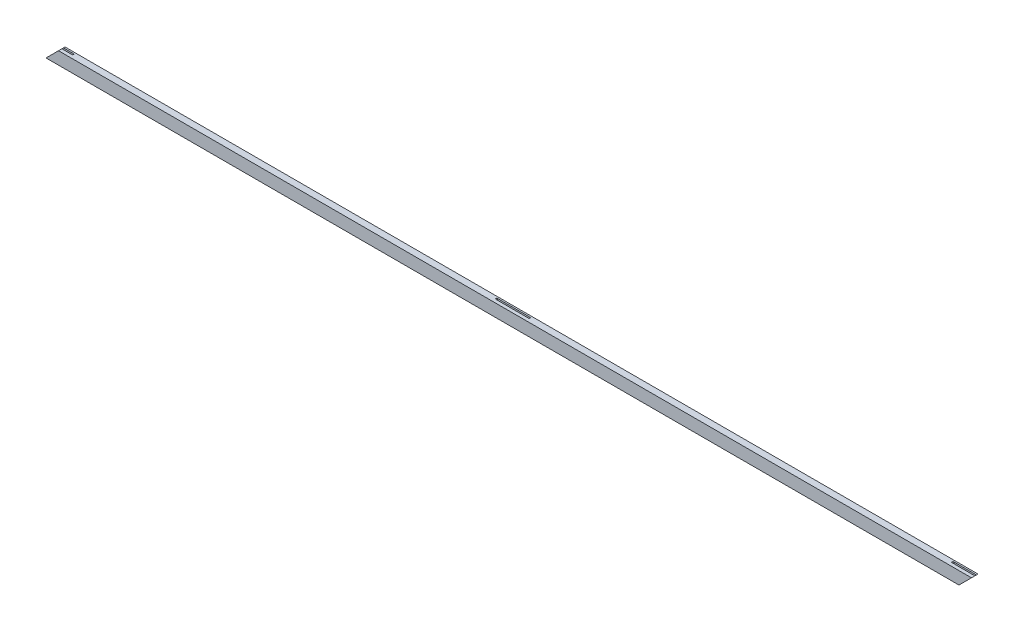
from build123d import *

# Parameters (mm, degrees)
EXTRUDE_1_DEPTH     = 25
SKETCH_2_W          = 115
SKETCH_2_H          = 6
CUT_EXTRUDE_1_DEPTH = 7.5
DRAFT_1_ANGLE       = 45
MIRROR_START        = 6
MIRROR_1_DEPTH      = 6
CUT_EXTRUDE_START   = -13
CUT_EXTRUDE_2_DEPTH = 6


# Read off the part's stored shape, not the designer's step: 镜向1
with BuildPart() as part:
    # 草图1 → 凸台-拉伸1 (new body)
    with BuildSketch(Plane.XY):
        Polygon((48, 48), (0, 0), (3498, 0), (3546, 48), align=None)
    extrude(amount=EXTRUDE_1_DEPTH)

    # 草图2 → 切除-拉伸1 (cut)
    with BuildSketch(Plane.XZ):
        with Locations((1773, 9)):
            Rectangle(SKETCH_2_W, SKETCH_2_H)
    extrude(amount=-CUT_EXTRUDE_1_DEPTH, mode=Mode.SUBTRACT)

    # 拔模1
    draft_1_faces = [part.faces().sort_by_distance(p)[0] for p in [
        (1830.5, 3.75, 9),
        (1715.5, 3.75, 9),
    ]]
    draft(draft_1_faces, Plane(origin=(0, 7.5, 0), x_dir=(0, 0, -1), z_dir=(0, -1, 0)), DRAFT_1_ANGLE)

    # 镜向1 outline → 镜向1 (cut)
    with BuildSketch(Plane.XY.offset(MIRROR_START)):
        Polygon((1708, 48), (1715.5, 40.5), (1830.5, 40.5), (1838, 48), align=None)
    extrude(amount=MIRROR_1_DEPTH, mode=Mode.SUBTRACT)

    # 草图3 → 切除-拉伸2 (cut)
    with BuildSketch(Plane.XY.offset(25).offset(CUT_EXTRUDE_START)):
        Polygon((3456.5, 48), (3464, 40.5), (3538.5, 40.5), (3546, 48), align=None)
        Polygon((3456.5, 0), (3464, 7.5), (3505.5, 7.5), (3498, 0), align=None)
        Polygon((48, 48), (40.5, 40.5), (82, 40.5), (89.5, 48), align=None)
        Polygon((0, 0), (7.5, 7.5), (82, 7.5), (89.5, 0), align=None)
    extrude(amount=-CUT_EXTRUDE_2_DEPTH, mode=Mode.SUBTRACT)


solid = part.part
